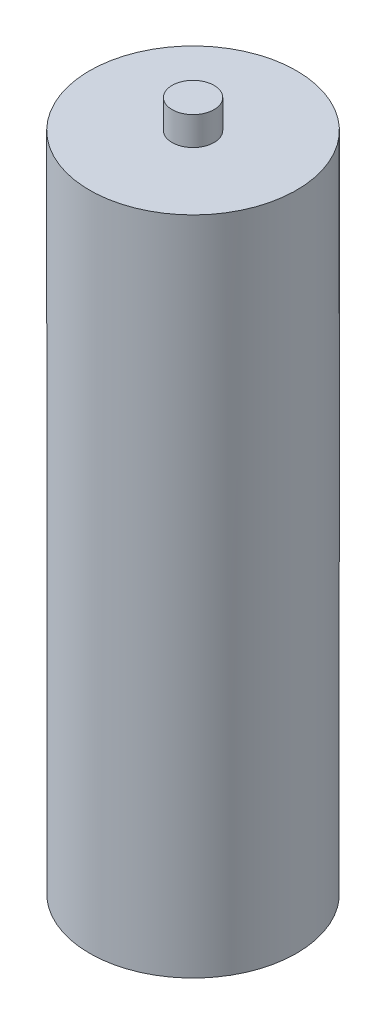
from build123d import *
from build123d.topology import SkipClean

# Parameters (mm, degrees)
SKETCH1_R           = 7.25
BOSS_EXTRUDE1_DEPTH = 46
SKETCH2_R           = 7
CUT_EXTRUDE1_DEPTH  = 64.5
SKETCH4_R           = 7.25
BOSS_EXTRUDE2_DEPTH = 46
SKETCH6_R           = 1.471316345
BOSS_EXTRUDE3_DEPTH = 2


with BuildPart() as part:
    # Sketch1 → Boss-Extrude1 (new body)
    with BuildSketch(Plane(origin=(0, 0, 0), x_dir=(1, 0, 0), z_dir=(0, 1, 0))):
        Circle(SKETCH1_R)
    extrude(amount=BOSS_EXTRUDE1_DEPTH)

    # Sketch2 → Cut-Extrude1 (cut)
    with BuildSketch(Plane(origin=(0, 0.3, 0), x_dir=(-1, 0, 0), z_dir=(0, -1, 0))):
        Circle(SKETCH2_R)
    extrude(amount=-CUT_EXTRUDE1_DEPTH, mode=Mode.SUBTRACT)

    # Sketch4 → Boss-Extrude2 (add)
    with SkipClean():  # the faces are left unmerged after this step: merging them gives an invalid solid
        with BuildSketch(Plane(origin=(0, 0.3, 0), x_dir=(-1, 0, 0), z_dir=(0, -1, 0))):
            Circle(SKETCH4_R)
        extrude(amount=-BOSS_EXTRUDE2_DEPTH)
    add(part.part.scale(1), mode=Mode.REPLACE)  # the faces are merged on a copy

    # Sketch6 → Boss-Extrude3 (add)
    with BuildSketch(Plane(origin=(0, 46.3, 0), x_dir=(1, 0, 0), z_dir=(0, 1, 0))):
        Circle(SKETCH6_R)
    extrude(amount=BOSS_EXTRUDE3_DEPTH)


solid = part.part
